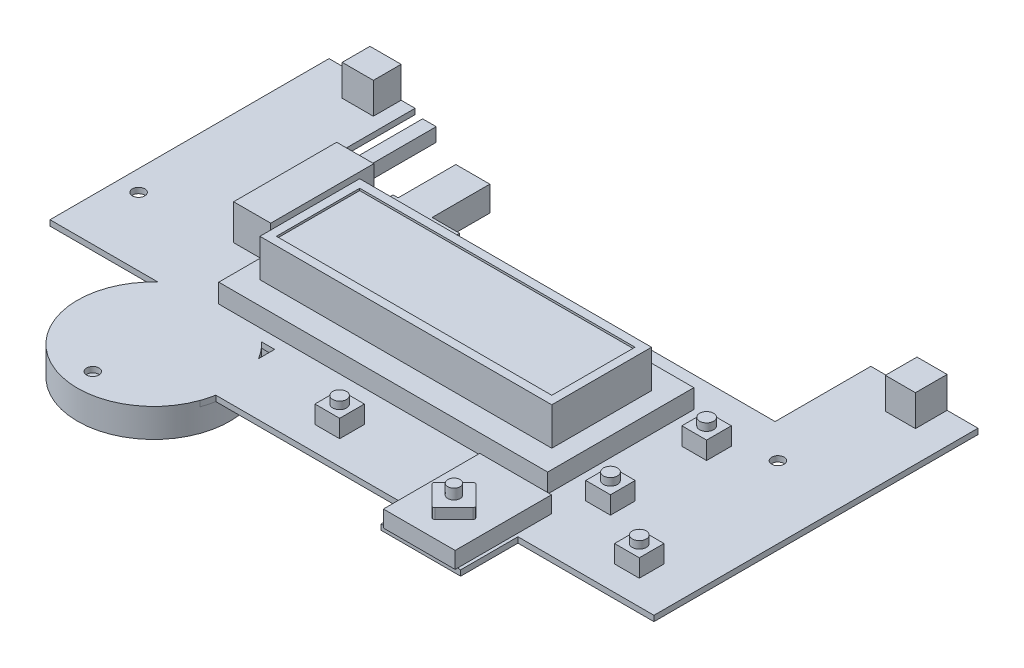
from build123d import *

# Parameters (mm, degrees)
BOSS_EXTRUDE1_DEPTH  = 1.35
SKETCH2_W            = 7.3
SKETCH2_H            = 7.681120631
BOSS_EXTRUDE2_DEPTH  = 7.55
SKETCH3_W            = 7.56
SKETCH3_H            = 6.737859852
BOSS_EXTRUDE3_DEPTH  = 7.55
SKETCH4_R            = 1.65
BOSS_EXTRUDE4_DEPTH  = 1.8
SKETCH5_W            = 79.8
SKETCH5_H            = 35.47
BOSS_EXTRUDE5_DEPTH  = 4.61
SKETCH6_W            = 70.81
SKETCH6_H            = 24.2
BOSS_EXTRUDE6_DEPTH  = 9.13
SKETCH7_W            = 6
SKETCH7_H            = 6
BOSS_EXTRUDE7_DEPTH  = 4.3
SKETCH8_R            = 1.69
BOSS_EXTRUDE8_DEPTH  = 1.8
SKETCH9_W            = 9
SKETCH9_H            = 25
BOSS_EXTRUDE9_DEPTH  = 8.6
SKETCH10_W           = 3.3
SKETCH10_H           = 3.3
BOSS_EXTRUDE10_DEPTH = 18
SKETCH11_W           = 6
SKETCH11_H           = 6
BOSS_EXTRUDE11_DEPTH = 4.3
SKETCH12_R           = 1.685
BOSS_EXTRUDE12_DEPTH = 1.8
SKETCH13_R           = 1.65
BOSS_EXTRUDE13_DEPTH = 2
SKETCH14_W           = 17.4
SKETCH14_H           = 23.38
BOSS_EXTRUDE14_DEPTH = 4
BOSS_EXTRUDE15_DEPTH = 2.5
SKETCH16_R           = 1.5
BOSS_EXTRUDE16_DEPTH = 2.5
FILLET1_R            = 0.5
BOSS_EXTRUDE17_DEPTH = 12.98
SKETCH18_W           = 16.12
SKETCH18_H           = 37.78
BOSS_EXTRUDE18_DEPTH = 12.98
SKETCH20_R           = 18.5
BOSS_EXTRUDE19_DEPTH = 6.95
SKETCH21_W           = 66.81
SKETCH21_H           = 20.2
CUT_EXTRUDE1_DEPTH   = 0.5
CUT_EXTRUDE2_START   = -1.35
SKETCH22_W           = 4
SKETCH22_H           = 22.15
CUT_EXTRUDE2_DEPTH   = 1.35
CUT_EXTRUDE3_DEPTH   = 1.35
SKETCH25_W           = 8.25
SKETCH25_H           = 6.08
BOSS_EXTRUDE20_DEPTH = 14
SKETCH26_R           = 1.5
CUT_EXTRUDE4_DEPTH   = 10
SKETCH27_W           = 3.58
SKETCH27_H           = 6.15
BOSS_EXTRUDE21_DEPTH = 16.39


with BuildPart() as part:
    # Sketch1 → Boss-Extrude1 (new body)
    with BuildSketch(Plane(origin=(0, 0, 0), x_dir=(1, 0, 0), z_dir=(0, 1, 0))):
        Polygon((41.44, 55.87), (41.44, 32.65), (34.44, 32.65), (-34.44, 32.65), (-64.07, 32.65), (-64.07, 54.8), (-88.94, 54.8), (-88.94, -12.9), (-34.44, -12.9), (-34.44, -32.65), (15.14, -32.65), (15.14, -36.65), (34.44, -36.65), (34.44, -32.65), (34.44, -22.75), (67.44, -22.75), (67.44, 55.87), align=None)
    extrude(amount=BOSS_EXTRUDE1_DEPTH)

    # Sketch2 → Boss-Extrude2 (add)
    with BuildSketch(Plane(origin=(0, 1.35, 0), x_dir=(1, 0, 0), z_dir=(0, 1, 0))):
        with Locations((56.29, 52.029439685)):
            Rectangle(SKETCH2_W, SKETCH2_H)
    extrude(amount=BOSS_EXTRUDE2_DEPTH)

    # Sketch3 → Boss-Extrude3 (add)
    with BuildSketch(Plane(origin=(0, 1.35, 0), x_dir=(1, 0, 0), z_dir=(0, 1, 0))):
        with Locations((-75.23, 51.431070074)):
            Rectangle(SKETCH3_W, SKETCH3_H)
    extrude(amount=BOSS_EXTRUDE3_DEPTH)

    # Sketch4 → Boss-Extrude4 (add)
    with BuildSketch(Plane(origin=(0, 0, -55.87), x_dir=(-1, 0, 0), z_dir=(0, 0, -1))):
        with Locations(Location((-56.29, 5.125, 0), (0, 0, 180))):
            Circle(SKETCH4_R)
        with Locations((75.23, 5.125)):
            Circle(SKETCH4_R)
    extrude(amount=BOSS_EXTRUDE4_DEPTH)


with BuildPart() as boss_extrude4_piece_1:
    # of the separate pieces the step leaves, piece 1, a body of its own (boss_extrude4_pieces)
    add(part.part.solids().sort_by_distance((41.44, 0, -55.87))[0])

    # Sketch5 → Boss-Extrude5 (add)
    with BuildSketch(Plane(origin=(0, 1.35, 0), x_dir=(1, 0, 0), z_dir=(0, 1, 0))):
        with Locations((-10.84, 7.575)):
            Rectangle(SKETCH5_W, SKETCH5_H)
    extrude(amount=BOSS_EXTRUDE5_DEPTH)

    # Sketch6 → Boss-Extrude6 (add)
    with BuildSketch(Plane(origin=(0, 5.96, 0), x_dir=(1, 0, 0), z_dir=(0, 1, 0))):
        with Locations((-10.845, 7.44)):
            Rectangle(SKETCH6_W, SKETCH6_H)
    extrude(amount=BOSS_EXTRUDE6_DEPTH)

    # Sketch7 → Boss-Extrude7 (add)
    with BuildSketch(Plane(origin=(0, 1.35, 0), x_dir=(1, 0, 0), z_dir=(0, 1, 0))):
        with Locations((38.31, 19.15)):
            Rectangle(SKETCH7_W, SKETCH7_H)
        with Locations((38.14, -4)):
            Rectangle(SKETCH7_W, SKETCH7_H)
        with Locations((54.88, -13.75)):
            Rectangle(SKETCH7_W, SKETCH7_H)
    extrude(amount=BOSS_EXTRUDE7_DEPTH)

    # Sketch8 → Boss-Extrude8 (add)
    with BuildSketch(Plane(origin=(0, 5.65, 0), x_dir=(1, 0, 0), z_dir=(0, 1, 0))):
        with Locations(Location((38.31, 19.15, 0), (0, 0, 270))):
            Circle(SKETCH8_R)
        with Locations(Location((38.14, -4, 0), (0, 0, 270))):
            Circle(SKETCH8_R)
        with Locations(Location((54.88, -13.75, 0), (0, 0, 270))):
            Circle(SKETCH8_R)
    extrude(amount=BOSS_EXTRUDE8_DEPTH)

    # Sketch9 → Boss-Extrude9 (add)
    with BuildSketch(Plane(origin=(0, 1.35, 0), x_dir=(1, 0, 0), z_dir=(0, 1, 0))):
        with Locations((-57.34, 17.05)):
            Rectangle(SKETCH9_W, SKETCH9_H)
    extrude(amount=BOSS_EXTRUDE9_DEPTH)

    # Sketch10 → Boss-Extrude10 (add)
    with BuildSketch(Plane(origin=(0, 0, -29.55), x_dir=(-1, 0, 0), z_dir=(0, 0, -1))):
        with Locations((57.34, 5.65)):
            Rectangle(SKETCH10_W, SKETCH10_H)
    extrude(amount=BOSS_EXTRUDE10_DEPTH)

    # Sketch11 → Boss-Extrude11 (add)
    with BuildSketch(Plane(origin=(0, 1.35, 0), x_dir=(1, 0, 0), z_dir=(0, 1, 0))):
        with Locations((-10.78, -20.79)):
            Rectangle(SKETCH11_W, SKETCH11_H)
    extrude(amount=BOSS_EXTRUDE11_DEPTH)

    # Sketch12 → Boss-Extrude12 (add)
    with BuildSketch(Plane(origin=(0, 5.65, 0), x_dir=(1, 0, 0), z_dir=(0, 1, 0))):
        with Locations(Location((-10.78, -20.79, 0), (0, 0, 270))):
            Circle(SKETCH12_R)
    extrude(amount=BOSS_EXTRUDE12_DEPTH)

    # Sketch13 → Boss-Extrude13 (add)
    with BuildSketch(Plane(origin=(0, 0, -54.8), x_dir=(-1, 0, 0), z_dir=(0, 0, -1))):
        with Locations(Location((75.23, 5.125, 0), (0, 0, 180))):
            Circle(SKETCH13_R)
    extrude(amount=BOSS_EXTRUDE13_DEPTH)

    # Sketch14 → Boss-Extrude14 (add)
    with BuildSketch(Plane(origin=(0, 1.35, 0), x_dir=(1, 0, 0), z_dir=(0, 1, 0))):
        with Locations((24.99, -25.55)):
            Rectangle(SKETCH14_W, SKETCH14_H)
    extrude(amount=BOSS_EXTRUDE14_DEPTH)

    # Sketch15 → Boss-Extrude15 (add)
    with BuildSketch(Plane(origin=(0, 5.35, 0), x_dir=(1, 0, 0), z_dir=(0, 1, 0))):
        Polygon((29.713300859, -28.24), (24.41, -33.543300859), (19.106699141, -28.24), (24.41, -22.936699141), align=None)
    extrude(amount=BOSS_EXTRUDE15_DEPTH)

    # Sketch16 → Boss-Extrude16 (add)
    with BuildSketch(Plane(origin=(0, 7.85, 0), x_dir=(1, 0, 0), z_dir=(0, 1, 0))):
        with Locations(Location((24.41, -28.24, 0), (0, 0, 270))):
            Circle(SKETCH16_R)
    extrude(amount=BOSS_EXTRUDE16_DEPTH)

    # Fillet1
    fillet1_edges = [boss_extrude4_piece_1.edges().sort_by_distance(p)[0] for p in [
        (19.106699141, 6.6, 28.24),
        (24.41, 6.6, 33.543300859),
        (29.713300859, 6.6, 28.24),
        (24.41, 6.6, 22.936699141),
    ]]
    fillet(fillet1_edges, radius=FILLET1_R)

    # Sketch17 → Boss-Extrude17 (add)
    with BuildSketch(Plane.XZ):
        Polygon((-28.84, 13.2), (4.96, 13.2), (4.96, -14.18), (-10.863816568, -31.554027432), (-28.84, -14.18), align=None)
    extrude(amount=BOSS_EXTRUDE17_DEPTH)

    # Sketch18 → Boss-Extrude18 (add)
    with BuildSketch(Plane.XZ):
        with Locations((-45.83, -16.39)):
            Rectangle(SKETCH18_W, SKETCH18_H)
    extrude(amount=BOSS_EXTRUDE18_DEPTH)

    # Sketch20 → Boss-Extrude19 (add)
    with BuildSketch(Plane(origin=(0, 1.35, 0), x_dir=(1, 0, 0), z_dir=(0, 1, 0))):
        with Locations(Location((-50.204576209, -26.472955965, 0), (0, 0, 270))):
            Circle(SKETCH20_R)
    extrude(amount=-BOSS_EXTRUDE19_DEPTH)


with BuildPart() as boss_extrude4_piece_2:
    # of the separate pieces the step leaves, piece 2, a body of its own (boss_extrude4_pieces)
    add(part.part.solids().sort_by_distance((-76.88, 5.125, -55.87))[0])


with BuildPart() as boss_extrude4_piece_1_1:
    # Body-Move/Copy2: read off the stored shape, not the designer's step
    # Body-Move/Copy2: moved
    add(boss_extrude4_piece_1.part.moved(Location((147.1362331, 0, -47.8050874))))


with BuildPart() as boss_extrude4_piece_1_2:
    # Body-Move/Copy3: read off the stored shape, not the designer's step
    # Body-Move/Copy3: moved
    add(boss_extrude4_piece_1_1.part.moved(Location((0, 8.4326513, 0))))

    # Sketch21 → Cut-Extrude1 (cut)
    with BuildSketch(Plane(origin=(0, 23.522651255, 0), x_dir=(1, 0, 0), z_dir=(0, 1, 0))):
        with Locations((136.291233088, 55.24508744)):
            Rectangle(SKETCH21_W, SKETCH21_H)
    extrude(amount=-CUT_EXTRUDE1_DEPTH, mode=Mode.SUBTRACT)

    # Sketch22 → Cut-Extrude2 (cut)
    with BuildSketch(Plane.XZ.offset(-8.432651255).offset(CUT_EXTRUDE2_START)):
        with Locations((81.066233088, -91.53008744)):
            Rectangle(SKETCH22_W, SKETCH22_H)
    extrude(amount=CUT_EXTRUDE2_DEPTH, mode=Mode.SUBTRACT)

    # Sketch24 → Cut-Extrude3 (cut)
    with BuildSketch(Plane.XZ.offset(-8.432651255)):
        with BuildLine():
            Line((114.36995172, -15.15508744), (162.276233088, -15.15508744))
            Line((162.276233088, -15.15508744), (162.276233088, -18.15508744))
            Line((162.276233088, -18.15508744), (115.164298686, -18.15508744))
            ThreePointArc((115.164298686, -18.15508744), (114.831908539, -16.637933958), (114.36995172, -15.15508744))
        make_face()
    extrude(amount=-CUT_EXTRUDE3_DEPTH, mode=Mode.SUBTRACT)

    # Sketch25 → Boss-Extrude20 (add)
    with BuildSketch(Plane(origin=(0, 0, -83.08508744), x_dir=(-1, 0, 0), z_dir=(0, 0, -1))):
        with Locations((-98.601233088, 5.392651255)):
            Rectangle(SKETCH25_W, SKETCH25_H)
    extrude(amount=BOSS_EXTRUDE20_DEPTH)

    # Sketch26 → Cut-Extrude4 (cut)
    with BuildSketch(Plane.XZ.offset(-8.432651255)):
        with Locations(Location((197.136233088, -72.57508744, 0), (0, 0, 270))):
            Circle(SKETCH26_R)
        with Locations(Location((95.276233088, -8.20508744, 0), (0, 0, 270))):
            Circle(SKETCH26_R)
        with Locations(Location((63.196233088, -51.40508744, 0), (0, 0, 270))):
            Circle(SKETCH26_R)
    extrude(amount=-CUT_EXTRUDE4_DEPTH, mode=Mode.SUBTRACT)

    # Sketch27 → Boss-Extrude21 (add)
    with BuildSketch(Plane.XZ.offset(4.547348745)):
        with Locations((146.306233088, -44.93008744)):
            Rectangle(SKETCH27_W, SKETCH27_H)
    extrude(amount=BOSS_EXTRUDE21_DEPTH)


solid = boss_extrude4_piece_1_2.part
